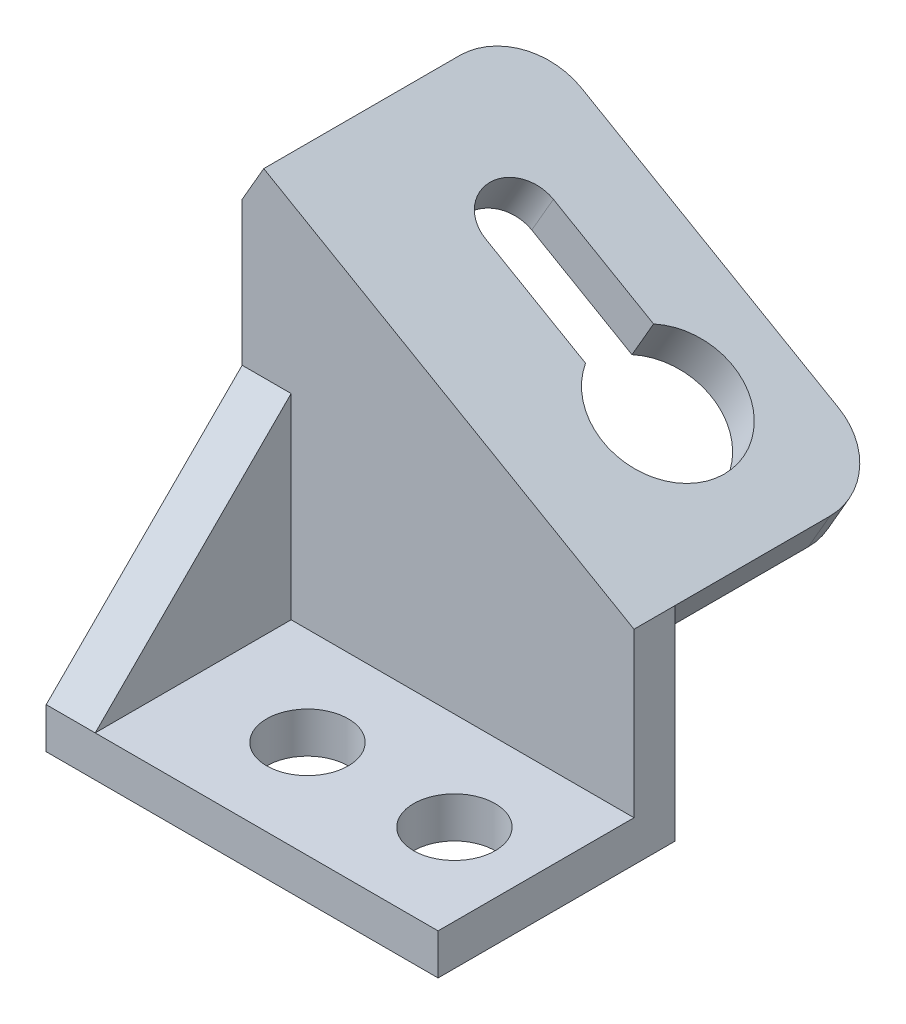
from build123d import *

# Parameters (mm, degrees)
EXTRUDE_1_DEPTH          = 72
EXTRUDE_START            = -7.5
EXTRUDE_1_2_DEPTH        = 7.5
SKETCH_3_W               = 83.138438763
SKETCH_3_H               = 48
EXTRUDE_2_DEPTH          = 7.9375
CUT_EXTRUDE_3_DEPTH      = 113.294938278
CUT_EXTRUDE_3_DEPTH_BACK = 113.294938278
FILLET_1_R               = 12
RIB_1_REACH              = 112.849
SKETCH_5_WALL_W          = 274.608976958
SKETCH_5_WALL_H          = 9
SKETCH_6_R               = 7.5
CUT_EXTRUDE_4_DEPTH      = 111.848644356


# Read off the part's stored shape, not the designer's step: 伸長1
with BuildPart() as part:
    # 草圖1 → Extrude 1 (new body)
    with BuildSketch(Plane(origin=(0, 0, 0), x_dir=(0, 0, -1), z_dir=(1, 0, 0))):
        Polygon((-36, 0), (0, 0), (0, 30), (7.5, 30), (7.5, -7.5), (-36, -7.5), align=None)
    extrude(amount=EXTRUDE_1_DEPTH)

    # Extrude 1 2 outline → Extrude 1 2 (add)
    with BuildSketch(Plane.XY.offset(EXTRUDE_START)):
        Polygon((72, 30), (0, 71.569219382), (0, 30), align=None)
    extrude(amount=EXTRUDE_1_2_DEPTH)

    # 草圖3 → 伸長2 (add)
    with BuildSketch(Plane(origin=(30.990381057, 53.676914536, 0), x_dir=(0.866025403784438, -0.5000000000000011, 0), z_dir=(0.5000000000000011, 0.8660254037844382, 0))):
        with Locations((5.784609691, 24)):
            Rectangle(SKETCH_3_W, SKETCH_3_H)
        with BuildLine():
            Line((-8.146170928, 33.25), (13.109928448, 33.25))
            ThreePointArc((13.109928448, 33.25), (35.353829072, 27), (13.109928448, 20.75))
            Line((13.109928448, 20.75), (-8.146170928, 20.75))
            ThreePointArc((-8.146170928, 20.75), (-14.396170928, 27), (-8.146170928, 33.25))
        make_face(mode=Mode.SUBTRACT)
    extrude(amount=-EXTRUDE_2_DEPTH)

    # 草圖4 → 伸長3 (cut, two sides: drawn at the far end of the back side and taken through both)
    with BuildSketch(Plane.XY.offset(-CUT_EXTRUDE_3_DEPTH_BACK)):
        Polygon((-110.576347035, -129.120067321), (0, 62.403783858), (8.212239163, 76.627799333), (118.788586198, 268.151650512), (-264.259116161, 489.304344581), (-493.624049393, 92.032626748), align=None)
    extrude(amount=CUT_EXTRUDE_3_DEPTH + CUT_EXTRUDE_3_DEPTH_BACK, mode=Mode.SUBTRACT)

    # 圓角1
    fillet_1_edges = [part.edges().sort_by_distance(p)[0] for p in [
        (70.015625, 26.562961679, -48),
        (1.984375, 65.84082218, -48),
    ]]
    fillet(fillet_1_edges, radius=FILLET_1_R)

    # 草圖5 wall → 肋材1 (add, up to next)
    with BuildSketch(Plane(origin=(0, 18, 18), x_dir=(0, -0.707106781187, 0.707106781187), z_dir=(0, 0.707106781187, 0.707106781187)), mode=Mode.PRIVATE) as rib_1_sk1:
        with Locations((0, 4.5)):
            Rectangle(SKETCH_5_WALL_W, SKETCH_5_WALL_H)
    rib_1_tool1 = extrude(rib_1_sk1.sketch, amount=-RIB_1_REACH, mode=Mode.PRIVATE) - part.part
    add(rib_1_tool1.solids().sort_by_distance((0, 18, 18))[0])

    # 草圖6 → 伸長4 (cut, through all)
    with BuildSketch(Plane(origin=(0, 0, 0), x_dir=(1, 0, 0), z_dir=(0, 1, 0))):
        with Locations(Location((57, -18, 0), (0, 0, 270))):
            Circle(SKETCH_6_R)
        with Locations(Location((30, -18, 0), (0, 0, 270))):
            Circle(SKETCH_6_R)
    extrude(amount=-CUT_EXTRUDE_4_DEPTH, mode=Mode.SUBTRACT)


solid = part.part
